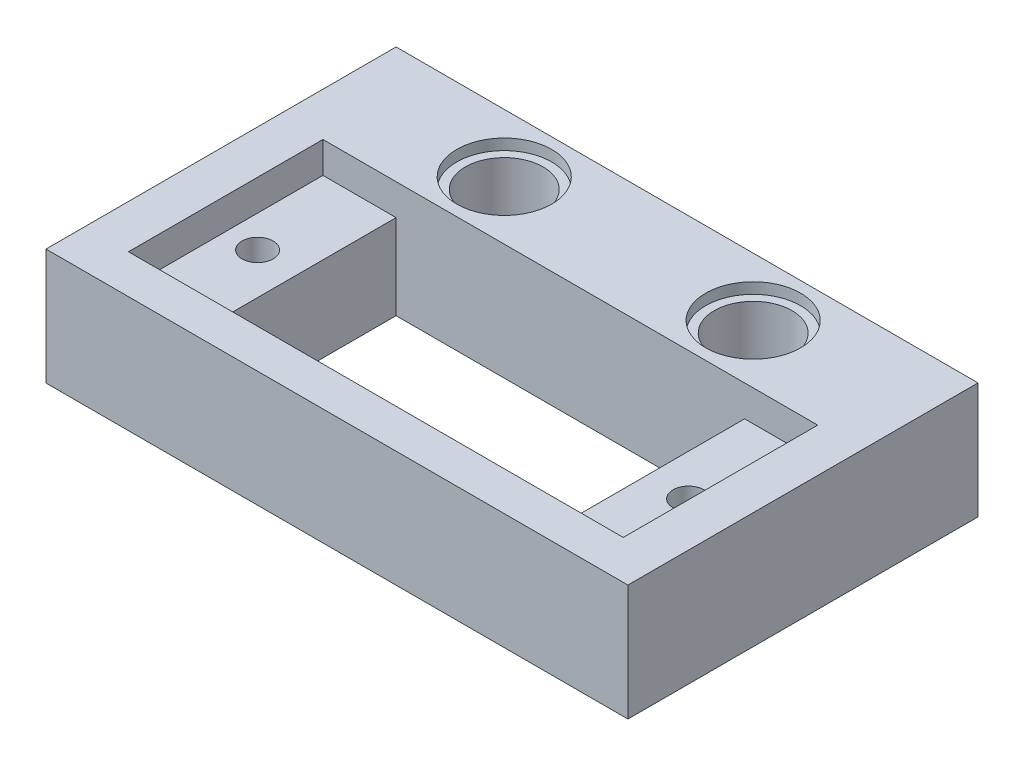
from build123d import *

# Parameters (mm, degrees)
SKETCH1_W           = 37.4
SKETCH1_H           = 22.5
SKETCH1_R           = 1
SKETCH1_W_2         = 22.4
SKETCH1_H_2         = 12.5
BOSS_EXTRUDE1_DEPTH = 7.46
SKETCH2_W           = 31.8
SKETCH2_H           = 12.5
CUT_EXTRUDE1_DEPTH  = 2
SKETCH3_R           = 2.5
CUT_EXTRUDE2_DEPTH  = 25.380404016
SKETCH4_R           = 3.05
CUT_EXTRUDE3_DEPTH  = 0.7
CUT_EXTRUDE4_START  = -0.7
SKETCH5_R           = 3.05
CUT_EXTRUDE4_DEPTH  = 0.7


with BuildPart() as part:
    # Sketch1 → Boss-Extrude1 (new body)
    with BuildSketch(Plane(origin=(0, 0, 0), x_dir=(1, 0, 0), z_dir=(0, 1, 0))):
        with Locations((0, 2.5)):
            Rectangle(SKETCH1_W, SKETCH1_H)
        with Locations((13.85, 0)):
            Circle(SKETCH1_R, mode=Mode.SUBTRACT)
        with Locations((-13.85, 0)):
            Circle(SKETCH1_R, mode=Mode.SUBTRACT)
        Rectangle(SKETCH1_W_2, SKETCH1_H_2, mode=Mode.SUBTRACT)
    extrude(amount=-BOSS_EXTRUDE1_DEPTH)

    # Sketch2 → Cut-Extrude1 (cut)
    with BuildSketch(Plane(origin=(0, 0, 0), x_dir=(1, 0, 0), z_dir=(0, 1, 0))):
        Rectangle(SKETCH2_W, SKETCH2_H)
    extrude(amount=-CUT_EXTRUDE1_DEPTH, mode=Mode.SUBTRACT)

    # Sketch3 → Cut-Extrude2 (cut, through all)
    with BuildSketch(Plane(origin=(0, 0, 0), x_dir=(1, 0, 0), z_dir=(0, 1, 0))):
        with Locations((8, 10)):
            Circle(SKETCH3_R)
        with Locations((-8, 10)):
            Circle(SKETCH3_R)
    extrude(amount=-CUT_EXTRUDE2_DEPTH, mode=Mode.SUBTRACT)

    # Sketch4 → Cut-Extrude3 (cut)
    with BuildSketch(Plane(origin=(0, 0, 0), x_dir=(1, 0, 0), z_dir=(0, 1, 0))):
        with Locations((-8, 10)):
            Circle(SKETCH4_R)
        with Locations((8, 10)):
            Circle(SKETCH4_R)
    extrude(amount=-CUT_EXTRUDE3_DEPTH, mode=Mode.SUBTRACT)

    # Sketch5 → Cut-Extrude4 (cut)
    with BuildSketch(Plane(origin=(0, -7.46, 0), x_dir=(-1, 0, 0), z_dir=(0, -1, 0)).offset(CUT_EXTRUDE4_START)):
        with Locations((-8, 10)):
            Circle(SKETCH5_R)
        with Locations((8, 10)):
            Circle(SKETCH5_R)
    extrude(amount=CUT_EXTRUDE4_DEPTH, mode=Mode.SUBTRACT)


solid = part.part
